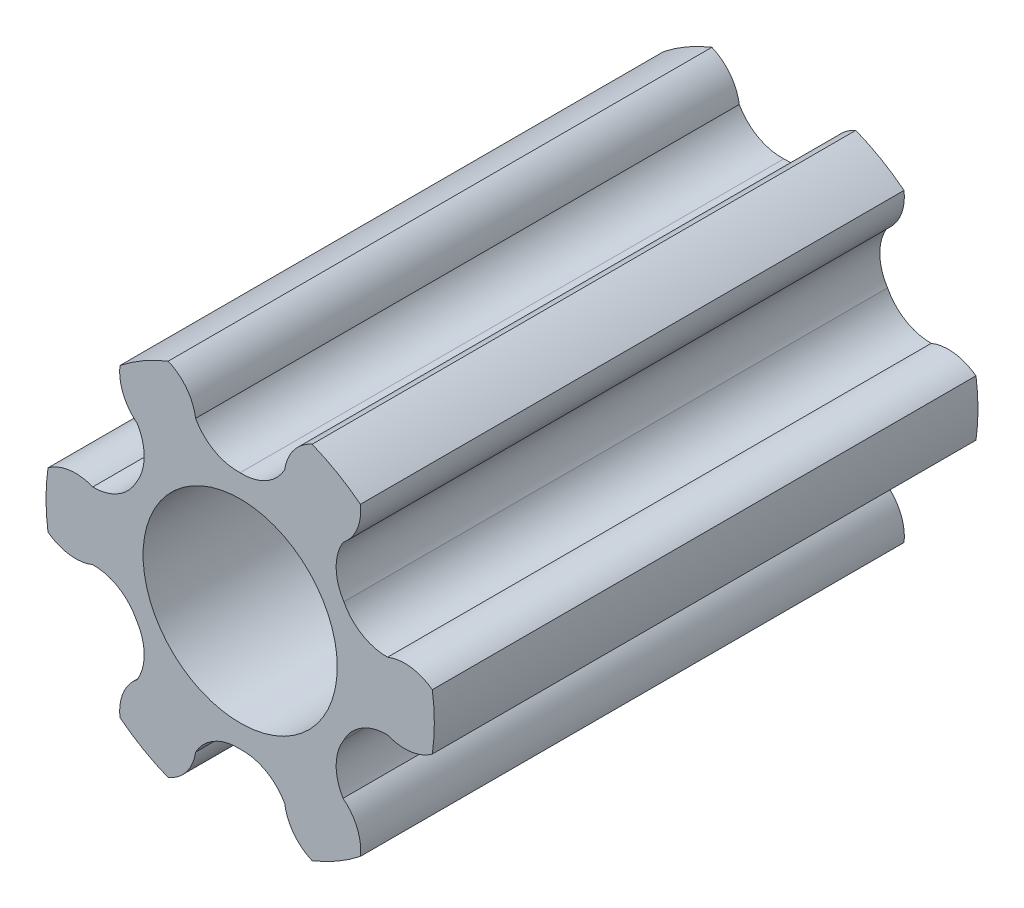
from build123d import *

# Parameters (mm, degrees)
SKETCH1_R           = 10
SKETCH1_R_2         = 5
BOSS_EXTRUDE1_DEPTH = 28
CUT_EXTRUDE1_DEPTH  = 32.368774283
CIRPATTERN1_COUNT   = 6


with BuildPart() as part:
    # Sketch1 → Boss-Extrude1 (new body)
    with BuildSketch(Plane.XY):
        Circle(SKETCH1_R)
        Circle(SKETCH1_R_2, mode=Mode.SUBTRACT)
    extrude(amount=BOSS_EXTRUDE1_DEPTH)

    # Sketch2 → Cut-Extrude1 (cut, through all)
    with BuildSketch(Plane.XY):
        with BuildLine():
            ThreePointArc((-5.720224173, 9.22190104), (-3.549386775, 9.214375914), (-2.294707734, 7.442830785))
            ThreePointArc((-2.294707734, 7.442830785), (-1.330340452, 6.475448814), (0, 6.165567522))
            ThreePointArc((0, 6.165567522), (1.330340452, 6.475448814), (2.294707734, 7.442830785))
            ThreePointArc((2.294707734, 7.442830785), (3.549386775, 9.214375914), (5.720224173, 9.22190104))
            ThreePointArc((5.720224173, 9.22190104), (3.122883005, 11.55237184), (0, 13.109573507))
            ThreePointArc((0, 13.109573507), (-3.122883005, 11.55237184), (-5.720224173, 9.22190104))
        make_face()
    cut_extrude1 = extrude(amount=CUT_EXTRUDE1_DEPTH, mode=Mode.SUBTRACT)

    # CirPattern1: Cut-Extrude1 ×6 about axis
    cirpattern1_axis = Axis((0, 0, 28), (0, 0, -1))
    for i in range(1, CIRPATTERN1_COUNT):
        add(cut_extrude1.rotate(cirpattern1_axis, i * 360 / CIRPATTERN1_COUNT), mode=Mode.SUBTRACT)


solid = part.part
